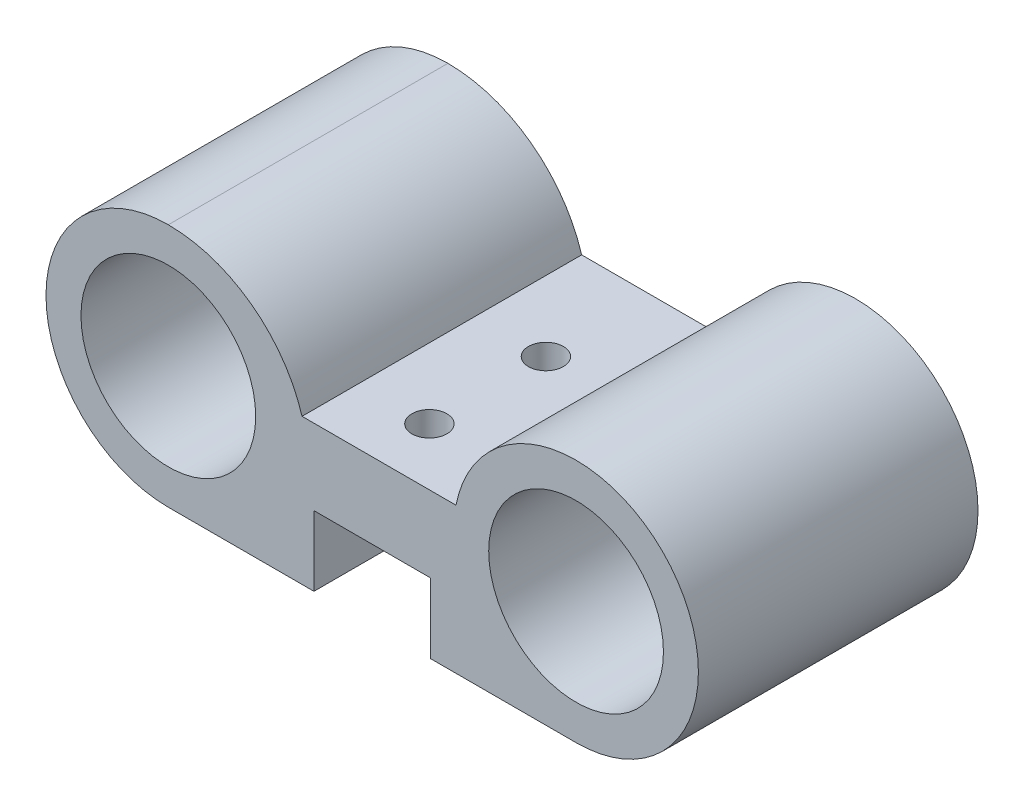
from build123d import *

# Parameters (mm, degrees)
SKETCH2_R           = 7.5
BOSS_EXTRUDE1_DEPTH = 24
SKETCH4_R           = 1.5
CUT_EXTRUDE1_DEPTH  = 10


with BuildPart() as part:
    # Sketch2 → Boss-Extrude1 (new body)
    with BuildSketch(Plane.XY):
        with BuildLine():
            Line((-17.5, -6), (-5, -6))
            Line((-5, -6), (-5, 0))
            Line((-5, 0), (5, 0))
            Line((5, 0), (5, -6))
            Line((5, -6), (17.5, -6))
            ThreePointArc((17.5, -6), (28, 4.5), (17.5, 15))
            ThreePointArc((17.5, 15), (10.819805392, 12.600925873), (7.192235936, 6.5))
            Line((7.192235936, 6.5), (-4.5, 6.5))
            Line((-4.5, 6.5), (-6.021759717, 6.5))
            ThreePointArc((-6.021759717, 6.5), (-10.358571571, 12.643650761), (-17.5, 15))
            ThreePointArc((-17.5, 15), (-28, 4.5), (-17.5, -6))
        make_face()
        with Locations((-17.5, 4.5)):
            Circle(SKETCH2_R, mode=Mode.SUBTRACT)
        with Locations((17.5, 4.5)):
            Circle(SKETCH2_R, mode=Mode.SUBTRACT)
    extrude(amount=BOSS_EXTRUDE1_DEPTH)

    # Sketch4 → Cut-Extrude1 (cut)
    with BuildSketch(Plane.XZ):
        with Locations((0, 9.091048368)):
            Circle(SKETCH4_R)
        with Locations((0, 19.091048368)):
            Circle(SKETCH4_R)
    extrude(amount=-CUT_EXTRUDE1_DEPTH, mode=Mode.SUBTRACT)


solid = part.part
